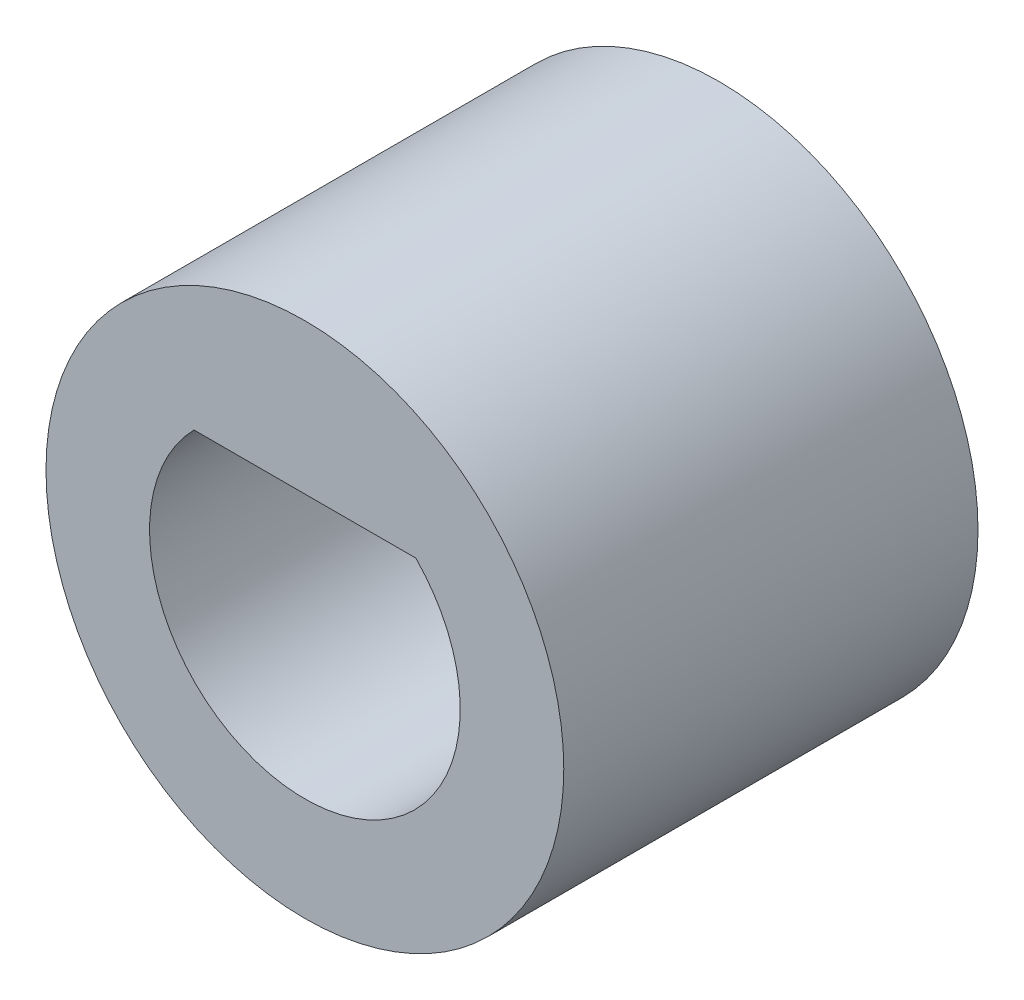
from build123d import *

# Parameters (mm, degrees)
ESQUISSE1_R        = 5
BOSS_EXTRU_1_DEPTH = 8


with BuildPart() as part:
    # Esquisse1 → Boss.-Extru.1 (new body)
    with BuildSketch(Plane.XY):
        Circle(ESQUISSE1_R)
        with BuildLine():
            Line((-2.142428529, 2.1), (2.142428529, 2.1))
            ThreePointArc((2.142428529, 2.1), (0, -3), (-2.142428529, 2.1))
        make_face(mode=Mode.SUBTRACT)
    extrude(amount=BOSS_EXTRU_1_DEPTH)


solid = part.part
